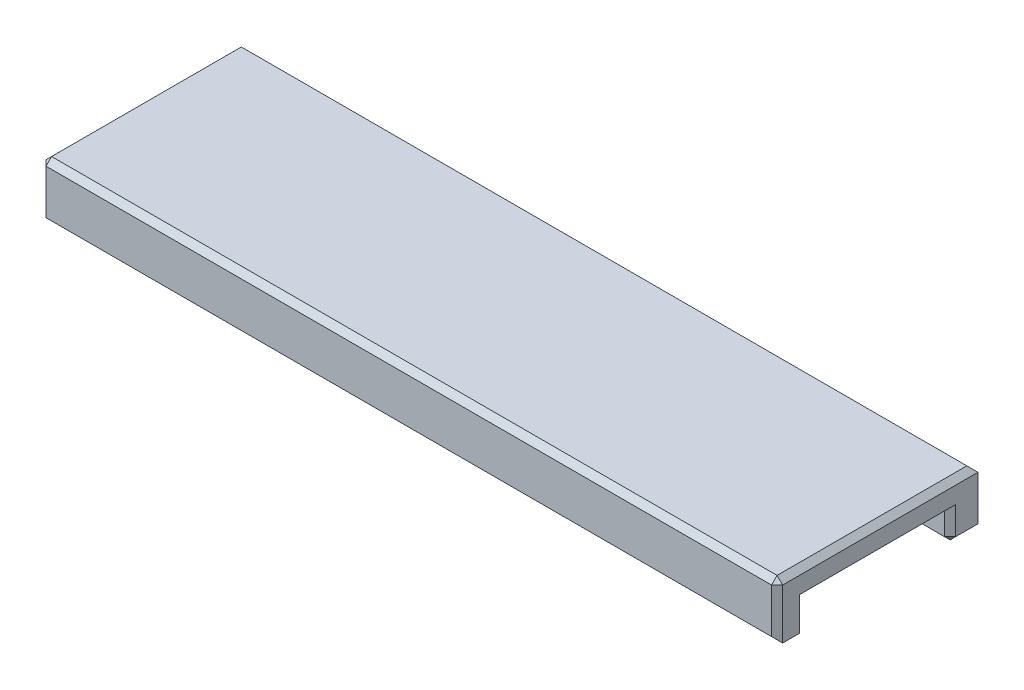
from build123d import *

# Parameters (mm, degrees)
SKETCH1_W               = 132
SKETCH1_H               = 36
BOSS_EXTRUDE1_DEPTH     = 5
CUT_EXTRUDE1_DEPTH      = 69.593002559
CUT_EXTRUDE1_DEPTH_BACK = 69.593002559
SKETCH2_W               = 26
SKETCH2_H               = 5
CHAMFER1_SIZE           = 1


with BuildPart() as part:
    # Sketch1 → Boss-Extrude1 (new, symmetric)
    with BuildSketch(Plane(origin=(0, 0, 0), x_dir=(1, 0, 0), z_dir=(0, 1, 0))):
        Rectangle(SKETCH1_W, SKETCH1_H)
    extrude(amount=BOSS_EXTRUDE1_DEPTH, both=True)

    # Sketch2 → Cut-Extrude1 (cut, two sides: drawn at the far end of the back side and taken through both)
    with BuildSketch(Plane(origin=(0, 0, 0), x_dir=(0, 0, -1), z_dir=(1, 0, 0)).offset(-CUT_EXTRUDE1_DEPTH_BACK)):
        with Locations((0, -2.5)):
            Rectangle(SKETCH2_W, SKETCH2_H)
    extrude(amount=CUT_EXTRUDE1_DEPTH + CUT_EXTRUDE1_DEPTH_BACK, mode=Mode.SUBTRACT)

    # Chamfer1
    chamfer1_edges = [part.edges().sort_by_distance(p)[0] for p in [
        (-66, -2.5, 13),
        (-66, -5, -15.5),
        (-66, 0, 0),
        (-66, -2.5, -13),
        (66, -5, -15.5),
        (66, -2.5, -13),
        (66, 0, 0),
        (66, -2.5, 13),
        (0, -5, 18),
        (66, 0, 18),
        (66, 5, 0),
        (0, 5, -18),
        (-66, 5, 0),
        (0, 5, 18),
        (-66, 0, 18),
        (0, -5, -13),
        (0, -5, 13),
    ]]
    chamfer(chamfer1_edges, length=CHAMFER1_SIZE)


solid = part.part
